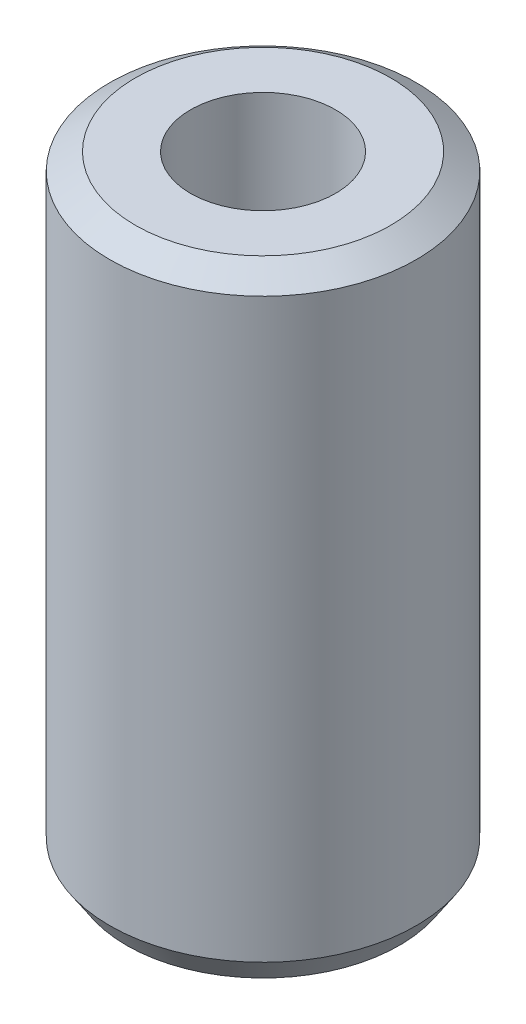
from build123d import *
from OCP.BRepFilletAPI import BRepFilletAPI_MakeChamfer

# Parameters (mm, degrees)
SKETCH1_R           = 42.5
BOSS_EXTRUDE1_DEPTH = 171.681697897
SKETCH2_R           = 20.103129508
CUT_EXTRUDE1_DEPTH  = 182.898612949
CHAMFER1_SIZE       = 4.689984685
CHAMFER1_SIZE2      = 7.098329966


with BuildPart() as part:
    # Sketch1 → Boss-Extrude1 (new body)
    with BuildSketch(Plane(origin=(0, 0, 0), x_dir=(1, 0, 0), z_dir=(0, 1, 0))):
        Circle(SKETCH1_R)
    extrude(amount=BOSS_EXTRUDE1_DEPTH)

    # Sketch2 → Cut-Extrude1 (cut, through all)
    with BuildSketch(Plane(origin=(0, 0, 0), x_dir=(1, 0, 0), z_dir=(0, 1, 0))):
        Circle(SKETCH2_R)
    extrude(amount=CUT_EXTRUDE1_DEPTH, mode=Mode.SUBTRACT)

    # Chamfer1: one chamfer whose edges measure the first distance from different faces: ONE call of the kernel's chamfer builder (chamfer() names one face for all edges)
    chamfer1_edges_1 = [part.edges().sort_by_distance(p)[0] for p in [
        (-42.5, 171.681697897, 0),
    ]]
    chamfer1_side_1 = [part.faces().sort_by_distance(p)[0] for p in [
        (-42.5, 85.840848948, 0),
    ]]
    chamfer1_edges_2 = [part.edges().sort_by_distance(p)[0] for p in [
        (-42.5, 0, 0),
    ]]
    chamfer1_side_2 = [part.faces().sort_by_distance(p)[0] for p in [
        (-41.297918472, 0, 0),
    ]]
    chamfer1 = BRepFilletAPI_MakeChamfer(part.part.solid().wrapped)
    for e in chamfer1_edges_1:
        chamfer1.Add(CHAMFER1_SIZE, CHAMFER1_SIZE2, e.wrapped, chamfer1_side_1[0].wrapped)  # the first distance lies on this face
    for e in chamfer1_edges_2:
        chamfer1.Add(CHAMFER1_SIZE, CHAMFER1_SIZE2, e.wrapped, chamfer1_side_2[0].wrapped)  # the first distance lies on this face
    add(Compound.cast(chamfer1.Shape()), mode=Mode.REPLACE)


solid = part.part
